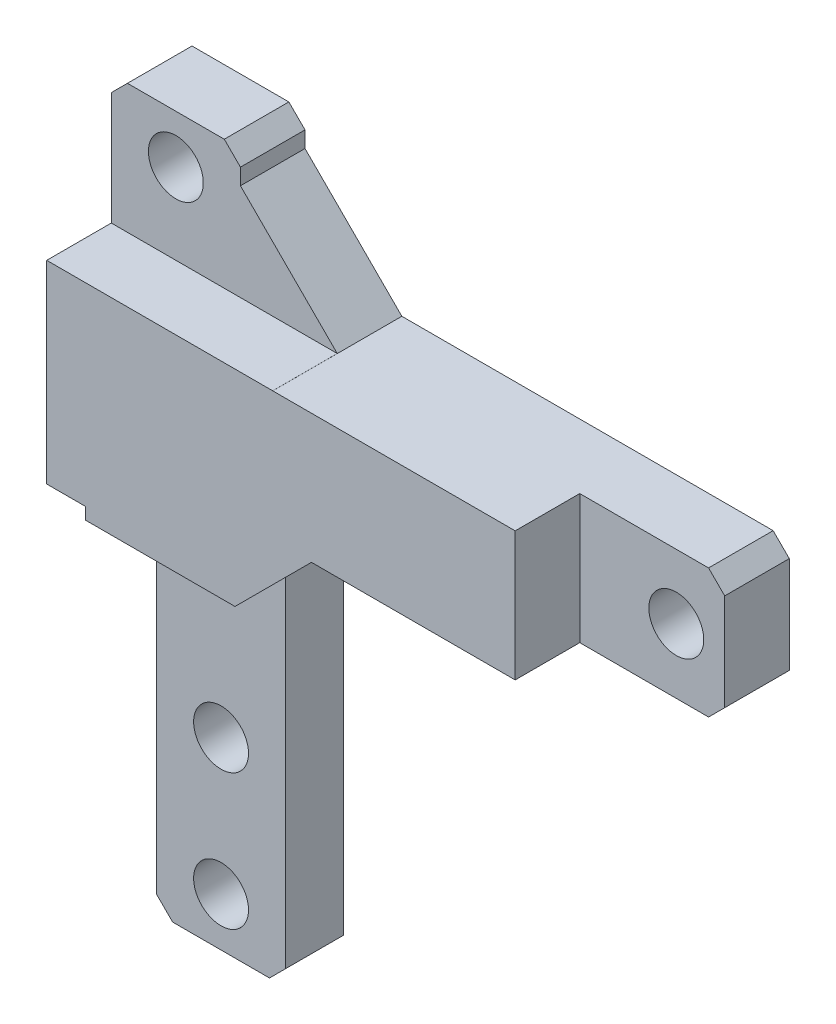
from build123d import *

# Parameters (mm, degrees)
SKETCH_1_R          = 0.85
EXTRUDE_1_DEPTH     = 4
CUT_EXTRUDE_START   = -2.2
SKETCH_2_W          = 4
SKETCH_2_H          = 11.631287185
SKETCH_2_R          = 0.85
CUT_EXTRUDE_1_DEPTH = 2.2
CUT_EXTRUDE_START_2 = 2
SKETCH_3_W          = 4.48994314
SKETCH_3_H          = 4
SKETCH_3_R          = 0.85
SKETCH_3_W_2        = 4
SKETCH_3_H_2        = 3.998874997
CUT_EXTRUDE_2_DEPTH = 2
CHAMFER_1_SIZE      = 3
CHAMFER_2_SIZE      = 0.5


with BuildPart() as part:
    # 草图1 → 凸台-拉伸1 (new body)
    with BuildSketch(Plane.XY):
        Polygon((-4.3, -2.5), (9.5, -2.5), (9.5, 1.5), (-5.5, 1.5), (-5.5, 5.5), (-9.5, 5.5), (-9.5, 1.5), (-9.5, -4.5), (-8.3, -4.5), (-8.3, -16.5), (-4.3, -16.5), align=None)
        with Locations((8, -0.5)):
            Circle(SKETCH_1_R, mode=Mode.SUBTRACT)
        with Locations((-7.5, 4)):
            Circle(SKETCH_1_R, mode=Mode.SUBTRACT)
        with Locations((-6.3, -15)):
            Circle(SKETCH_1_R, mode=Mode.SUBTRACT)
        with Locations((-6.3, -10.8)):
            Circle(SKETCH_1_R, mode=Mode.SUBTRACT)
    extrude(amount=EXTRUDE_1_DEPTH)

    # 草图2 → 切除-拉伸1 (cut)
    with BuildSketch(Plane.XY.offset(4).offset(CUT_EXTRUDE_START)):
        with Locations((-6.3, -10.684356408)):
            Rectangle(SKETCH_2_W, SKETCH_2_H)
        with Locations((-6.3, -15)):
            Circle(SKETCH_2_R, mode=Mode.SUBTRACT)
        with Locations((-6.3, -10.8)):
            Circle(SKETCH_2_R, mode=Mode.SUBTRACT)
    extrude(amount=CUT_EXTRUDE_1_DEPTH, mode=Mode.SUBTRACT)

    # 草图3 → 切除-拉伸2 (cut)
    # profile 1 of 2: a face of its own
    with BuildSketch(Plane(origin=(0, 0, 4), x_dir=(-1, 0, 0), z_dir=(0, 0, -1)).offset(CUT_EXTRUDE_START_2)):
        with Locations((-7.25502843, -0.5)):
            Rectangle(SKETCH_3_W, SKETCH_3_H)
        with Locations((-8, -0.5)):
            Circle(SKETCH_3_R, mode=Mode.SUBTRACT)
    # profile 2 of 2: a face of its own
    with BuildSketch(Plane(origin=(0, 0, 4), x_dir=(-1, 0, 0), z_dir=(0, 0, -1)).offset(CUT_EXTRUDE_START_2)):
        with Locations((7.5, 3.500562502)):
            Rectangle(SKETCH_3_W_2, SKETCH_3_H_2)
        with Locations((7.5, 4)):
            Circle(SKETCH_3_R, mode=Mode.SUBTRACT)
    extrude(amount=-CUT_EXTRUDE_2_DEPTH, mode=Mode.SUBTRACT)

    # 倒角1
    chamfer_1_edges = [part.edges().sort_by_distance(p)[0] for p in [
        (-4.3, -2.5, 2),
        (-5.5, 1.5, 2),
    ]]
    chamfer(chamfer_1_edges, length=CHAMFER_1_SIZE)

    # 倒角2
    chamfer_2_edges = [part.edges().sort_by_distance(p)[0] for p in [
        (-4.3, -16.5, 0.9),
        (-8.3, -16.5, 0.9),
        (-9.5, 5.5, 1),
        (9.5, -2.5, 1),
        (9.5, 1.5, 1),
        (-5.5, 5.5, 1),
    ]]
    chamfer(chamfer_2_edges, length=CHAMFER_2_SIZE)


solid = part.part
